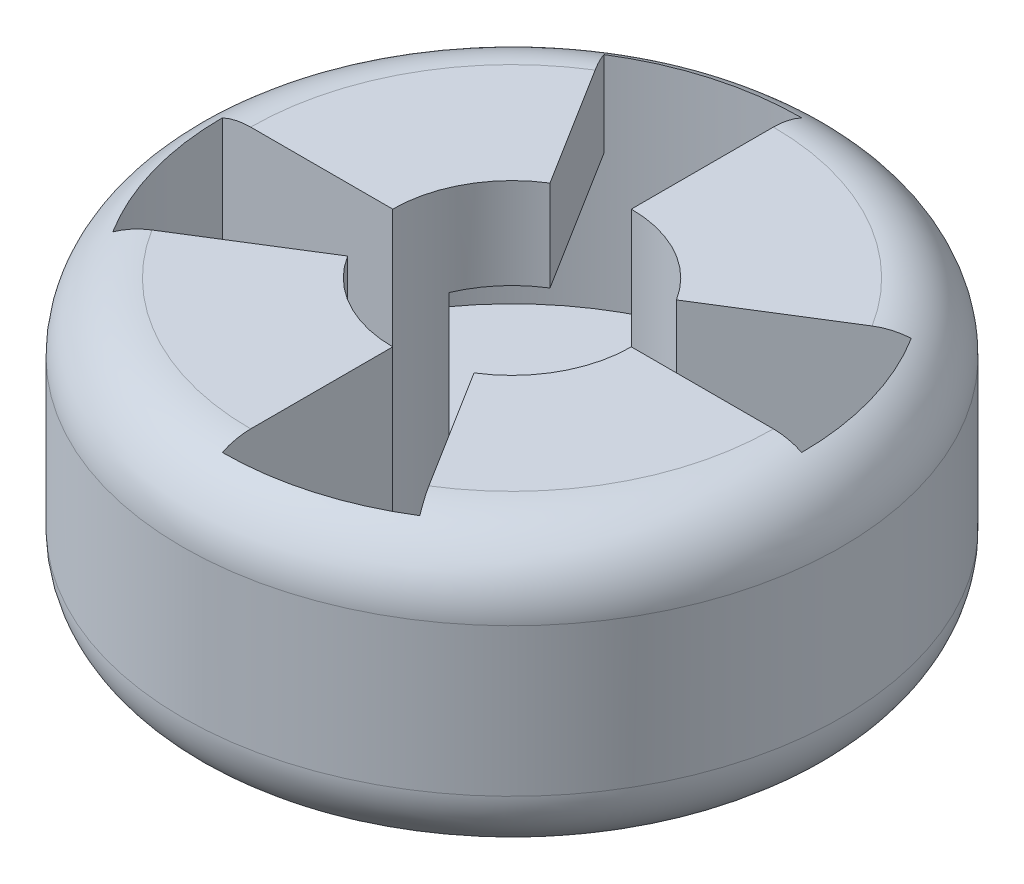
from build123d import *

# Parameters (mm, degrees)
SKETCH2_W          = 9.25
SKETCH2_H          = 12.5
CUT_EXTRUDE1_DEPTH = 10
CIRPATTERN1_COUNT  = 4
CUT_EXTRUDE2_DEPTH = 10
CUT_EXTRUDE3_START = 6
CUT_EXTRUDE3_DEPTH = 6
CIRPATTERN2_COUNT  = 2
FILLET1_R          = 3


with BuildPart() as part:
    # Sketch2 → Revolve1 (revolve)
    with BuildSketch(Plane(origin=(0, 0, 0), x_dir=(0, 0, -1), z_dir=(1, 0, 0))):
        with Locations((-9.875, 6.25)):
            Rectangle(SKETCH2_W, SKETCH2_H)
    revolve(axis=Axis((0, 31, 0), (0, -1, 0)))

    # Sketch3 → Cut-Extrude1 (cut)
    with BuildSketch(Plane(origin=(0, 12.5, 0), x_dir=(1, 0, 0), z_dir=(0, 1, 0))):
        with BuildLine():
            Line((-6.756470619, 10.812613226), (0, 0))
            Line((0, 0), (0, 12.75))
            ThreePointArc((0, 12.75), (-3.514376287, 12.256086623), (-6.756470619, 10.812613226))
        make_face()
    cut_extrude1 = extrude(amount=-CUT_EXTRUDE1_DEPTH, mode=Mode.SUBTRACT)

    # CirPattern1: Cut-Extrude1 ×4 about axis
    cirpattern1_axis = Axis((0, 12.5, 0), (0, 1, 0))
    for i in range(1, CIRPATTERN1_COUNT):
        add(cut_extrude1.rotate(cirpattern1_axis, i * 360 / CIRPATTERN1_COUNT), mode=Mode.SUBTRACT)

    # Sketch4 → Cut-Extrude2 (cut)
    with BuildSketch(Plane(origin=(0, 2.5, 0), x_dir=(1, 0, 0), z_dir=(0, 1, 0))):
        with BuildLine():
            Line((5.25, 0), (12.75, 0))
            ThreePointArc((12.75, 0), (12.256086623, 3.514376287), (10.812613226, 6.756470619))
            Line((10.812613226, 6.756470619), (4.452252505, 2.782076137))
            ThreePointArc((4.452252505, 2.782076137), (5.046623904, 1.447096118), (5.25, 0))
        make_face()
        with BuildLine():
            Line((-5.25, 0), (-12.75, 0))
            ThreePointArc((-12.75, 0), (-12.256086623, -3.514376287), (-10.812613226, -6.756470619))
            Line((-10.812613226, -6.756470619), (-4.452252505, -2.782076137))
            ThreePointArc((-4.452252505, -2.782076137), (-5.046623904, -1.447096118), (-5.25, 0))
        make_face()
    extrude(amount=-CUT_EXTRUDE2_DEPTH, mode=Mode.SUBTRACT)

    # Sketch5 → Cut-Extrude3 (cut)
    with BuildSketch(Plane(origin=(0, 2.5, 0), x_dir=(1, 0, 0), z_dir=(0, 1, 0)).offset(CUT_EXTRUDE3_START)):
        with BuildLine():
            Line((0, 0), (-6.756470619, 10.812613226))
            ThreePointArc((-6.756470619, 10.812613226), (-9.695176061, 8.280462616), (-11.736436882, 4.981821888))
            Line((-11.736436882, 4.981821888), (0, 0))
        make_face()
    cut_extrude3 = extrude(amount=-CUT_EXTRUDE3_DEPTH, mode=Mode.SUBTRACT)

    # CirPattern2: Cut-Extrude3 ×2 about axis
    cirpattern2_axis = Axis((0, 12.5, 0), (0, 1, 0))
    for i in range(1, CIRPATTERN2_COUNT):
        add(cut_extrude3.rotate(cirpattern2_axis, i * 360 / CIRPATTERN2_COUNT), mode=Mode.SUBTRACT)

    # Fillet1
    # the kernel refuses this fillet: 3 mm, written as the material it takes off along each edge
    with BuildSketch(Plane(origin=(0, 12.5, 0), x_dir=(0, 0, 1), z_dir=(1, 0, 0))) as fillet1_piece_1:
        with BuildLine():
            CenterArc((14.5 - FILLET1_R, FILLET1_R), FILLET1_R, 270, 90)
            Line((14.5, FILLET1_R), (14.5, 0))
            Line((14.5, 0), (14.5 - FILLET1_R, 0))
        make_face()
    revolve(axis=Axis((0, 12.5, 0), (0, -1, 0)), mode=Mode.SUBTRACT)
    with BuildSketch(Plane(origin=(0, 0, 0), x_dir=(0, 0, 1), z_dir=(1, 0, 0))) as fillet1_piece_2:
        with BuildLine():
            CenterArc((14.5 - FILLET1_R, -FILLET1_R), FILLET1_R, 360, 90)
            Line((14.5, -FILLET1_R), (14.5, 0))
            Line((14.5, 0), (14.5 - FILLET1_R, 0))
        make_face()
    revolve(axis=Axis((0, 0, 0), (0, -1, 0)), mode=Mode.SUBTRACT)


solid = part.part
